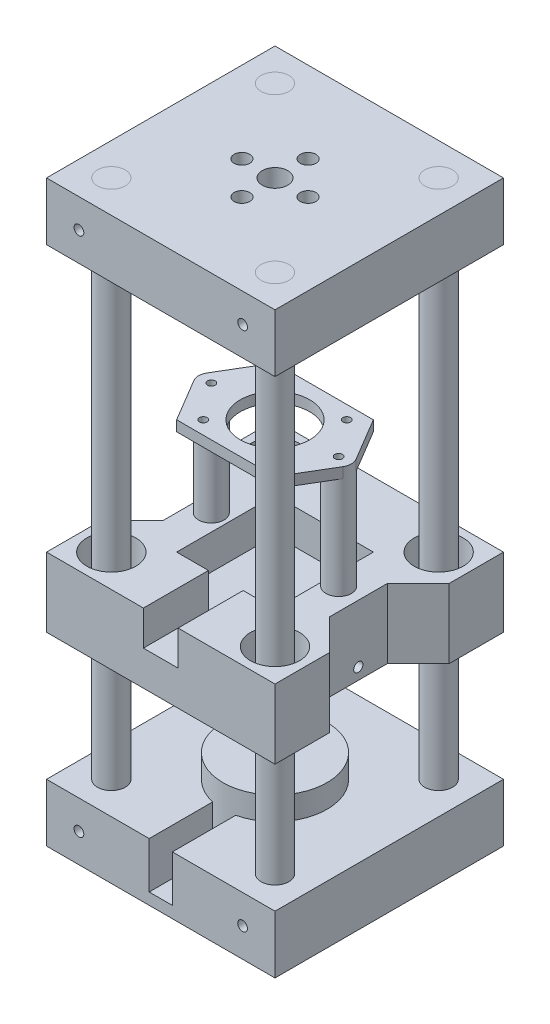
from build123d import *
from build123d.topology import SkipClean

# Parameters (mm, degrees)
SKETCH1_W               = 98.710678118
SKETCH1_H               = 98.710678118
SKETCH1_R               = 6
BOSS_EXTRUDE1_DEPTH     = 25
CUT_EXTRUDE5_REACH      = 115.158
SKETCH8_R               = 2.1
MIRROR3_COPY_1_REACH    = 115.158
MIRROR3_COPY_1_SKETCH_R = 2.1
SKETCH1_3_R             = 6
BOSS_EXTRUDE3_DEPTH     = 250
BOSS_EXTRUDE3_2_DEPTH   = 250
BOSS_EXTRUDE3_3_DEPTH   = 250
BOSS_EXTRUDE3_4_DEPTH   = 250
SKETCH3_R               = 20.32
SKETCH3_R_2             = 3.3782
SKETCH3_R_3             = 8.636
CUT_EXTRUDE1_DEPTH      = 10.414
SKETCH3_4_R             = 8.636
SKETCH3_4_R_2           = 5.5
CUT_EXTRUDE14_DEPTH     = 15.875
SKETCH3_2_R             = 5.5
SKETCH3_2_R_2           = 3.3782
CUT_EXTRUDE2_DEPTH      = 236.577798279
SKETCH10_R              = 22.5
CUT_EXTRUDE8_DEPTH      = 20
SKETCH4_W               = 98.710678118
SKETCH4_H               = 98.710678118
SKETCH4_R               = 10.6
BOSS_EXTRUDE7_DEPTH     = 30
SKETCH5_W               = 15
SKETCH5_H               = 28.105339059
CUT_EXTRUDE3_DEPTH      = 15
SKETCH14_W              = 22.5
SKETCH14_H              = 10
SKETCH16_R              = 2
CUT_EXTRUDE12_DEPTH     = 274.275954903
SKETCH9_R               = 1.65
SKETCH9_R_2             = 15
BOSS_EXTRUDE9_DEPTH     = 4.5
SKETCH9_3_R             = 5.5
SKETCH9_3_R_2           = 1.65
BOSS_EXTRUDE10_DEPTH    = 44
SKETCH9_4_R             = 1.65
CUT_EXTRUDE7_DEPTH      = 50
CUT_EXTRUDE13_START     = -110
CUT_EXTRUDE13_DEPTH     = 250


with BuildPart() as part:
    # Sketch1 → Boss-Extrude1 (new body)
    with BuildSketch(Plane(origin=(0, 0, 0), x_dir=(1, 0, 0), z_dir=(0, 1, 0))):
        Rectangle(SKETCH1_W, SKETCH1_H)
        with Locations(Location((-35.355339059, -35.355339059, 0), (0, 0, 270))):
            Circle(SKETCH1_R, mode=Mode.SUBTRACT)
        with Locations(Location((35.355339059, -35.355339059, 0), (0, 0, 270))):
            Circle(SKETCH1_R, mode=Mode.SUBTRACT)
        with Locations(Location((35.355339059, 35.355339059, 0), (0, 0, 270))):
            Circle(SKETCH1_R, mode=Mode.SUBTRACT)
        with Locations(Location((-35.355339059, 35.355339059, 0), (0, 0, 270))):
            Circle(SKETCH1_R, mode=Mode.SUBTRACT)
    extrude(amount=BOSS_EXTRUDE1_DEPTH)

    # Sketch8 → Cut-Extrude5 (cut, up to next)
    with BuildSketch(Plane.XY.offset(49.355339059), mode=Mode.PRIVATE) as cut_extrude5_sk1:
        with Locations((-35.355339059, 12.5)):
            Circle(SKETCH8_R)
    cut_extrude5_tool1 = extrude(cut_extrude5_sk1.sketch, amount=-CUT_EXTRUDE5_REACH, mode=Mode.PRIVATE) & part.part
    cut_extrude5 = cut_extrude5_tool1.solids().sort_by_distance((-35.355339, 12.5, 49.355339))[0]
    add(cut_extrude5, mode=Mode.SUBTRACT)

    # Mirror2: Cut-Extrude5 across plane
    add(cut_extrude5.mirror(Plane(origin=(0, 0, 0), x_dir=(0, 0, 1), z_dir=(1, 0, 0))), mode=Mode.SUBTRACT)

    # Mirror3: Cut-Extrude5 across plane
    add(cut_extrude5.mirror(Plane.XY), mode=Mode.SUBTRACT)

    # Mirror3 copy 1 sketch → Mirror3 copy 1 (cut, up to next)
    with BuildSketch(Plane(origin=(0, 0, -49.355339059), x_dir=(-1, 0, 0), z_dir=(0, 0, -1)), mode=Mode.PRIVATE) as mirror3_copy_1_sk1:
        with Locations((-35.355339059, 12.5)):
            Circle(MIRROR3_COPY_1_SKETCH_R)
    mirror3_copy_1_tool1 = extrude(mirror3_copy_1_sk1.sketch, amount=-MIRROR3_COPY_1_REACH, mode=Mode.PRIVATE) & part.part
    add(mirror3_copy_1_tool1.solids().sort_by_distance((35.355339, 12.5, -49.355339))[0], mode=Mode.SUBTRACT)


with BuildPart() as body_2:
    # Sketch1<3> → Boss-Extrude3 (new body)
    with BuildSketch(Plane(origin=(0, 0, 0), x_dir=(1, 0, 0), z_dir=(0, 1, 0))):
        with Locations(Location((-35.355339059, 35.355339059, 0), (0, 0, 270))):
            Circle(SKETCH1_3_R)
    extrude(amount=BOSS_EXTRUDE3_DEPTH)


with BuildPart() as body_3:
    # Sketch1<3> → Boss-Extrude3 2 (new body)
    with BuildSketch(Plane(origin=(0, 0, 0), x_dir=(1, 0, 0), z_dir=(0, 1, 0))):
        with Locations(Location((35.355339059, 35.355339059, 0), (0, 0, 270))):
            Circle(SKETCH1_3_R)
    extrude(amount=BOSS_EXTRUDE3_2_DEPTH)


with BuildPart() as body_4:
    # Sketch1<3> → Boss-Extrude3 3 (new body)
    with BuildSketch(Plane(origin=(0, 0, 0), x_dir=(1, 0, 0), z_dir=(0, 1, 0))):
        with Locations(Location((35.355339059, -35.355339059, 0), (0, 0, 270))):
            Circle(SKETCH1_3_R)
    extrude(amount=BOSS_EXTRUDE3_3_DEPTH)


with BuildPart() as body_5:
    # Sketch1<3> → Boss-Extrude3 4 (new body)
    with BuildSketch(Plane(origin=(0, 0, 0), x_dir=(1, 0, 0), z_dir=(0, 1, 0))):
        with Locations(Location((-35.355339059, -35.355339059, 0), (0, 0, 270))):
            Circle(SKETCH1_3_R)
    extrude(amount=BOSS_EXTRUDE3_4_DEPTH)


with BuildPart() as body_6:
    # Mirror1: mirrored copy
    add(part.part.mirror(Plane.ZX.offset(125)))

    # Sketch3 → Cut-Extrude1 (cut)
    with BuildSketch(Plane.XZ.offset(-225)):
        with Locations(Location((0, 0, 0), (0, 0, 270))):
            Circle(SKETCH3_R)
        with Locations(Location((0, 14.2875, 0), (0, 0, 270))):
            Circle(SKETCH3_R_2, mode=Mode.SUBTRACT)
        with Locations(Location((14.2875, 0, 0), (0, 0, 270))):
            Circle(SKETCH3_R_2, mode=Mode.SUBTRACT)
        with Locations(Location((0, -14.2875, 0), (0, 0, 270))):
            Circle(SKETCH3_R_2, mode=Mode.SUBTRACT)
        with Locations(Location((-14.2875, 0, 0), (0, 0, 270))):
            Circle(SKETCH3_R_2, mode=Mode.SUBTRACT)
        with Locations(Location((0, 0, 0), (0, 0, 270))):
            Circle(SKETCH3_R_3, mode=Mode.SUBTRACT)
    extrude(amount=-CUT_EXTRUDE1_DEPTH, mode=Mode.SUBTRACT)

    # Sketch3<4> → Cut-Extrude14 (cut)
    with BuildSketch(Plane.XZ.offset(-225)):
        with Locations(Location((0, 0, 0), (0, 0, 270))):
            Circle(SKETCH3_4_R)
        with Locations(Location((0, 0, 0), (0, 0, 270))):
            Circle(SKETCH3_4_R_2, mode=Mode.SUBTRACT)
    extrude(amount=-CUT_EXTRUDE14_DEPTH, mode=Mode.SUBTRACT)

    # Sketch3<2> → Cut-Extrude2 (cut, through all)
    with BuildSketch(Plane.XZ.offset(-225)):
        with Locations(Location((0, 0, 0), (0, 0, 270))):
            Circle(SKETCH3_2_R)
        with Locations(Location((0, 14.2875, 0), (0, 0, 270))):
            Circle(SKETCH3_2_R_2)
        with Locations(Location((14.2875, 0, 0), (0, 0, 270))):
            Circle(SKETCH3_2_R_2)
        with Locations(Location((0, -14.2875, 0), (0, 0, 270))):
            Circle(SKETCH3_2_R_2)
        with Locations(Location((-14.2875, 0, 0), (0, 0, 270))):
            Circle(SKETCH3_2_R_2)
    extrude(amount=-CUT_EXTRUDE2_DEPTH, mode=Mode.SUBTRACT)


with BuildPart() as part_1:
    add(part.part)

    # Sketch10 → Cut-Extrude8 (cut)
    with BuildSketch(Plane(origin=(0, 25, 0), x_dir=(1, 0, 0), z_dir=(0, 1, 0))):
        Circle(SKETCH10_R)
        with BuildLine():
            ThreePointArc((5, -21.937410968), (0, -22.5), (-5, -21.937410968))
            Line((-5, -21.937410968), (-5, -49.355339059))
            Line((-5, -49.355339059), (5, -49.355339059))
            Line((5, -49.355339059), (5, -21.937410968))
        make_face()
    extrude(amount=-CUT_EXTRUDE8_DEPTH, mode=Mode.SUBTRACT)


with BuildPart() as body_7:
    # Sketch11 → Revolve1 (revolve)
    with BuildSketch(Plane.XY, mode=Mode.PRIVATE) as revolve1_sk:
        Polygon((-22.5, 35), (0, 35), (0, 5), (-7, 5), (-22.5, 9.153212483), (-22.5, 25), align=None)
    revolve(revolve1_sk.sketch.rotate(Axis((0, 35, 0), (0, -1, 0)), 270), axis=Axis((0, 35, 0), (0, -1, 0)))


with BuildPart() as body_8:
    # Sketch4 → Boss-Extrude7 (new body)
    with BuildSketch(Plane(origin=(0, 80, 0), x_dir=(1, 0, 0), z_dir=(0, 1, 0))):
        Rectangle(SKETCH4_W, SKETCH4_H)
        with Locations(Location((-35.355339059, -35.355339059, 0), (0, 0, 270))):
            Circle(SKETCH4_R, mode=Mode.SUBTRACT)
        with Locations(Location((-35.355339059, 35.355339059, 0), (0, 0, 270))):
            Circle(SKETCH4_R, mode=Mode.SUBTRACT)
        with Locations(Location((35.355339059, -35.355339059, 0), (0, 0, 270))):
            Circle(SKETCH4_R, mode=Mode.SUBTRACT)
        with Locations(Location((35.355339059, 35.355339059, 0), (0, 0, 270))):
            Circle(SKETCH4_R, mode=Mode.SUBTRACT)
    extrude(amount=BOSS_EXTRUDE7_DEPTH)

    # Sketch5 → Cut-Extrude3 (cut)
    with BuildSketch(Plane(origin=(0, 110, 0), x_dir=(1, 0, 0), z_dir=(0, 1, 0))):
        Polygon((-21.25, -21.25), (21.25, -21.25), (-21.25, 21.25), align=None)
        Polygon((21.25, -21.25), (-21.25, 21.25), (21.25, 21.25), align=None)
        with Locations((0, -35.30266953)):
            Rectangle(SKETCH5_W, SKETCH5_H)
    extrude(amount=-CUT_EXTRUDE3_DEPTH, mode=Mode.SUBTRACT)

    # Sketch14 → Cut-Revolve1 (revolve, cut)
    with BuildSketch(Plane.XY):
        with Locations((-11.25, 85)):
            Rectangle(SKETCH14_W, SKETCH14_H)
    revolve(axis=Axis((0, 90, 0), (0, -1, 0)), mode=Mode.SUBTRACT)

    # Sketch16 → Cut-Extrude12 (cut, through all)
    with BuildSketch(Plane.ZY.offset(49.355339059)):
        with Locations((0, 85)):
            Circle(SKETCH16_R)
    extrude(amount=-CUT_EXTRUDE12_DEPTH, mode=Mode.SUBTRACT)

    # Sketch9<4> → Cut-Extrude7 (cut)
    with BuildSketch(Plane(origin=(0, 155, 0), x_dir=(1, 0, 0), z_dir=(0, 1, 0))):
        with Locations(Location((-27.5, 0, 0), (0, 0, 90))):
            Circle(SKETCH9_4_R)
        with Locations(Location((27.5, 0, 0), (0, 0, 90))):
            Circle(SKETCH9_4_R)
    extrude(amount=-CUT_EXTRUDE7_DEPTH, mode=Mode.SUBTRACT)

    # Sketch17 → Cut-Extrude13 (cut)
    with BuildSketch(Plane(origin=(0, 110, 0), x_dir=(1, 0, 0), z_dir=(0, 1, 0)).offset(CUT_EXTRUDE13_START)):
        Polygon((-36, 12.5), (-36, -12.5), (-49.355339059, -25.855339059), (-49.355339059, 25.855339059), align=None)
        Polygon((49.355339059, -25.855339059), (49.355339059, 25.855339059), (36, 12.5), (36, -12.5), align=None)
    extrude(amount=CUT_EXTRUDE13_DEPTH, mode=Mode.SUBTRACT)


with BuildPart() as body_9:
    # Sketch14<3> → Revolve2 (revolve)
    with BuildSketch(Plane.XY):
        Polygon((-22.5, 90), (-22.5, 88), (-15, 84.502692564), (-15, 80.5), (-22.5, 73), (-22.5, 68), (0, 68), (0, 90), align=None)
    revolve(axis=Axis((0, 90, 0), (0, -1, 0)))


with BuildPart() as body_10:
    # Sketch9 → Boss-Extrude9 (new body)
    with BuildSketch(Plane(origin=(0, 155, 0), x_dir=(1, 0, 0), z_dir=(0, 1, 0))):
        with BuildLine():
            Line((-21.25, 21.25), (-32.225907828, 2.813502302))
            ThreePointArc((-32.225907828, 2.813502302), (-33, 0), (-32.225907828, -2.813502302))
            Line((-32.225907828, -2.813502302), (-21.25, -21.25))
            Line((-21.25, -21.25), (21.25, -21.25))
            Line((21.25, -21.25), (32.225907828, -2.813502302))
            ThreePointArc((32.225907828, -2.813502302), (33, 0), (32.225907828, 2.813502302))
            Line((32.225907828, 2.813502302), (21.25, 21.25))
            Line((21.25, 21.25), (-21.25, 21.25))
        make_face()
        with Locations(Location((-15.5, -15.5, 0), (0, 0, 270))):
            Circle(SKETCH9_R, mode=Mode.SUBTRACT)
        with Locations(Location((15.5, -15.5, 0), (0, 0, 270))):
            Circle(SKETCH9_R, mode=Mode.SUBTRACT)
        with Locations(Location((-15.5, 15.5, 0), (0, 0, 270))):
            Circle(SKETCH9_R, mode=Mode.SUBTRACT)
        with Locations(Location((0, 0, 0), (0, 0, 270))):
            Circle(SKETCH9_R_2, mode=Mode.SUBTRACT)
        with Locations(Location((15.5, 15.5, 0), (0, 0, 270))):
            Circle(SKETCH9_R, mode=Mode.SUBTRACT)
        with Locations(Location((-27.5, 0, 0), (0, 0, 270))):
            Circle(SKETCH9_R, mode=Mode.SUBTRACT)
        with Locations(Location((27.5, 0, 0), (0, 0, 270))):
            Circle(SKETCH9_R, mode=Mode.SUBTRACT)
    extrude(amount=BOSS_EXTRUDE9_DEPTH)

    # Sketch9<3> → Boss-Extrude10 (add)
    # profile 1 of 2: a face of its own
    with SkipClean():  # the faces are left unmerged after this step: merging them gives an invalid solid
        with BuildSketch(Plane(origin=(0, 155, 0), x_dir=(1, 0, 0), z_dir=(0, 1, 0))):
            with Locations(Location((-27.5, 0, 0), (0, 0, 90))):
                Circle(SKETCH9_3_R)
            with Locations(Location((-27.5, 0, 0), (0, 0, 90))):
                Circle(SKETCH9_3_R_2, mode=Mode.SUBTRACT)
        # profile 2 of 2: a face of its own
        with BuildSketch(Plane(origin=(0, 155, 0), x_dir=(1, 0, 0), z_dir=(0, 1, 0))):
            with Locations(Location((27.5, 0, 0), (0, 0, 90))):
                Circle(SKETCH9_3_R)
            with Locations(Location((27.5, 0, 0), (0, 0, 90))):
                Circle(SKETCH9_3_R_2, mode=Mode.SUBTRACT)
        extrude(amount=-BOSS_EXTRUDE10_DEPTH)


solid = Compound([body_2.part, body_3.part, body_4.part, body_5.part, body_6.part, part_1.part, body_7.part, body_8.part, body_9.part, body_10.part])
